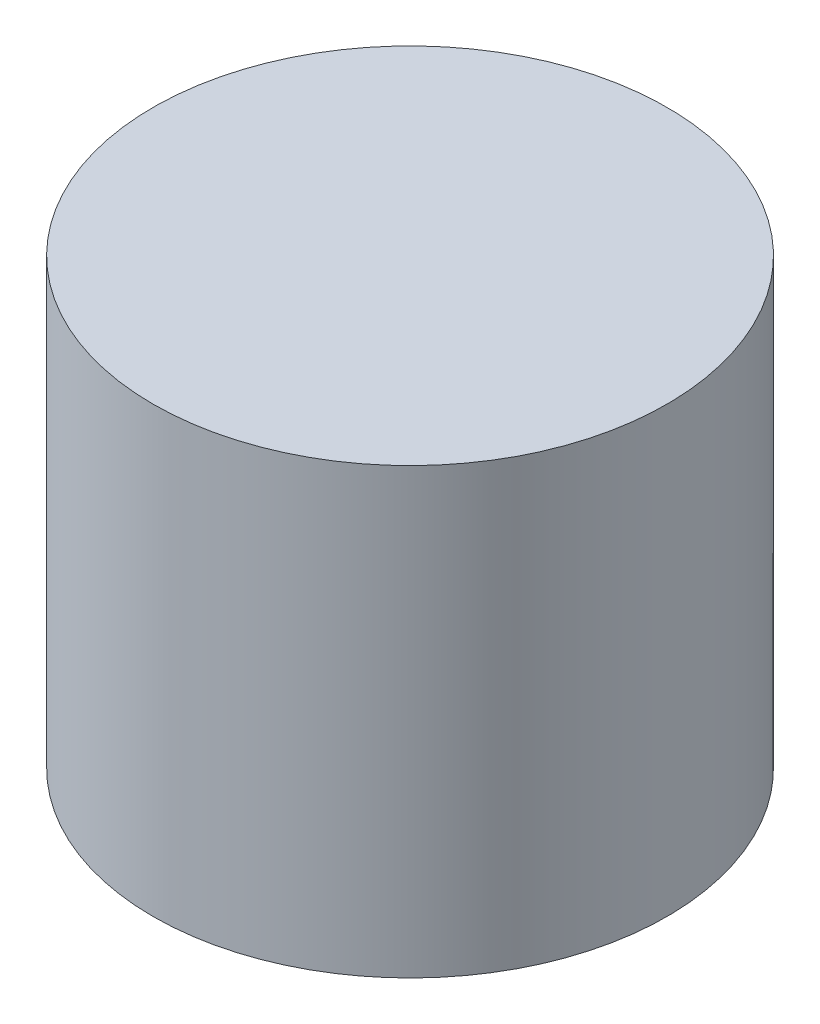
from build123d import *

# Parameters (mm, degrees)
SKETCH2_R           = 6.95
BOSS_EXTRUDE1_DEPTH = 12


with BuildPart() as part:
    # Sketch2 → Boss-Extrude1 (new body)
    with BuildSketch(Plane(origin=(0, 0, 0), x_dir=(1, 0, 0), z_dir=(0, 1, 0))):
        Circle(SKETCH2_R)
    extrude(amount=BOSS_EXTRUDE1_DEPTH)


solid = part.part
